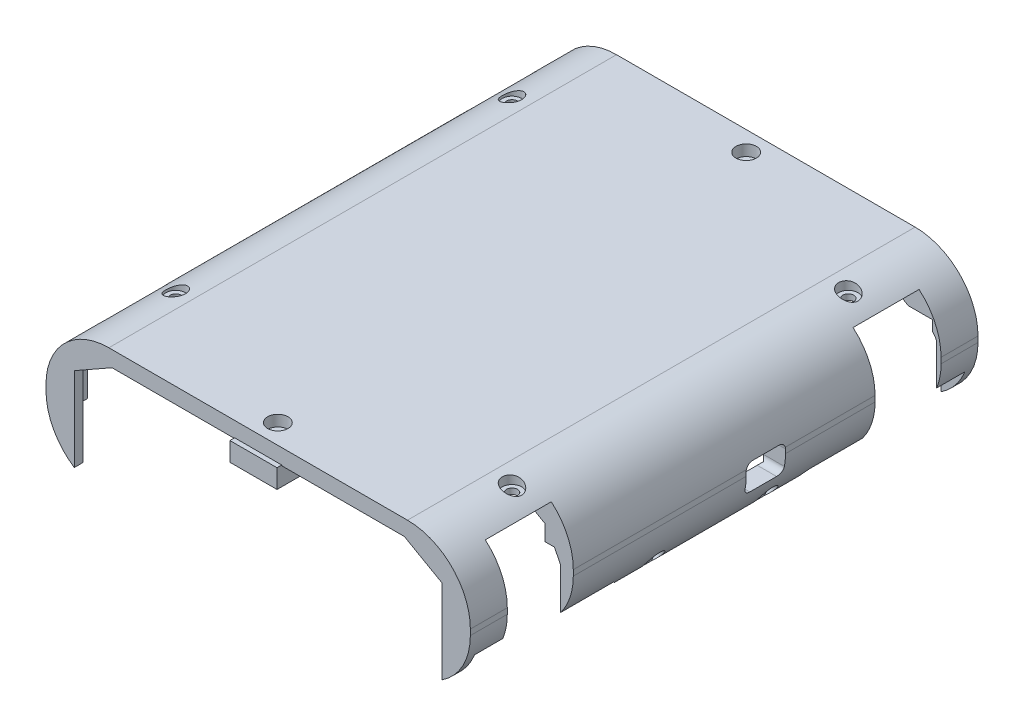
from build123d import *

# Parameters (mm, degrees)
BOSS_EXTRUDE1_DEPTH = 161.5
SKETCH11_W          = 21
SKETCH11_H          = 33.7
CUT_EXTRUDE7_DEPTH  = 214.141971465
CUT_EXTRUDE8_REACH  = 181.223
SKETCH12_R          = 1.75
SKETCH14_R          = 3.1
CUT_EXTRUDE9_DEPTH  = 3
CUT_EXTRUDE10_DEPTH = 9
BOSS_EXTRUDE5_DEPTH = 6
CUT_EXTRUDE11_REACH = 179.217
SKETCH20_R          = 1.75
SKETCH22_R          = 3.25
CUT_EXTRUDE12_DEPTH = 3.5
CUT_EXTRUDE13_START = -15
CUT_EXTRUDE13_DEPTH = 15
CHAMFER1_SIZE       = 7
MIRROR1_START       = -34
MIRROR1_OUTLINE_W   = 7.588235294
MIRROR1_OUTLINE_H   = 9
MIRROR1_DEPTH       = 18.20203721
MIRROR1_START_2     = -16.8
MIRROR1_2_OUTLINE_W = 6.338235294
MIRROR1_2_OUTLINE_H = 9
MIRROR1_2_DEPTH     = 10.8
MIRROR1_START_3     = 1.5
MIRROR1_3_OUTLINE_R = 3.25
MIRROR1_3_DEPTH     = 4.5
MIRROR1_4_OUTLINE_W = 1.25
MIRROR1_4_OUTLINE_H = 9
MIRROR1_4_DEPTH     = 5.4
MIRROR1_5_OUTLINE_R = 1.75
MIRROR1_5_DEPTH     = 1.5
MIRROR1_START_4     = -5.8
MIRROR1_6_OUTLINE_R = 1.75
MIRROR1_6_DEPTH     = 6
MIRROR1_START_5     = 32.75
MIRROR1_7_DEPTH     = 22
MIRROR1_START_6     = 149.75
MIRROR1_8_DEPTH     = 9
MIRROR1_START_7     = -15.79796279
MIRROR1_9_DEPTH     = 3.99796279
SKETCH24_W          = 32
SKETCH24_H          = 27
CUT_EXTRUDE14_DEPTH = 3
FILLET1_R           = 3
SKETCH25_W          = 8
SKETCH25_H          = 5
BOSS_EXTRUDE6_DEPTH = 8
CUT_EXTRUDE15_REACH = 119.19
CUT_EXTRUDE17_REACH = 216.281
SKETCH27_R          = 1.6
SKETCH28_R          = 3
CUT_EXTRUDE18_DEPTH = 7
SKETCH31_W          = 42
SKETCH31_H          = 65
CUT_EXTRUDE19_DEPTH = 6.8
SKETCH34_R          = 3
SKETCH34_W          = 6
SKETCH34_H          = 8.65
BOSS_EXTRUDE7_DEPTH = 3.5
SKETCH37_R          = 1.05
CUT_EXTRUDE21_DEPTH = 6.2
CUT_EXTRUDE22_DEPTH = 2
CUT_EXTRUDE23_REACH = 210.728
SKETCH40_W          = 12.5
SKETCH40_H          = 9
CHAMFER2_SIZE       = 2
FILLET2_R           = 2
SKETCH41_W          = 50
SKETCH41_H          = 4
SKETCH41_H_2        = 10
CUT_EXTRUDE24_DEPTH = 3.5
FILLET3_R           = 3.5
SKETCH43_R          = 3.5
BOSS_EXTRUDE8_DEPTH = 3
CUT_EXTRUDE28_REACH = 184.576
CUT_EXTRUDE28_START = 3
SKETCH48_W          = 11.5
SKETCH48_H          = 72
SKETCH44_R          = 2
CUT_EXTRUDE26_DEPTH = 5
CUT_EXTRUDE27_REACH = 210.728
SKETCH45_W          = 20
SKETCH45_H          = 8
CHAMFER3_SIZE       = 2
FILLET4_R           = 2
SKETCH46_R          = 2.75
SKETCH46_R_2        = 2.1
BOSS_EXTRUDE9_DEPTH = 2.3


with BuildPart() as part:
    # Sketch9 → Boss-Extrude1 (new body)
    with BuildSketch(Plane.XY):
        with BuildLine():
            Line((-47.5, 5), (47.5, 5))
            ThreePointArc((47.5, 5), (61.642135624, -0.857864376), (67.5, -15))
            Line((67.5, -15), (67.5, -16.8))
            ThreePointArc((67.5, -16.8), (65.106767147, -26.285383493), (58.5, -33.5))
            Line((58.5, -33.5), (58.5, -6.8))
            Line((58.5, -6.8), (46.5, 0))
            Line((46.5, 0), (-46.5, 0))
            Line((-46.5, 0), (-58.5, -6.8))
            Line((-58.5, -6.8), (-58.5, -33.5))
            ThreePointArc((-58.5, -33.5), (-65.106767147, -26.285383493), (-67.5, -16.8))
            Line((-67.5, -16.8), (-67.5, -15))
            ThreePointArc((-67.5, -15), (-61.642135624, -0.857864376), (-47.5, 5))
        make_face()
    extrude(amount=BOSS_EXTRUDE1_DEPTH)

    # Sketch11 → Cut-Extrude7 (cut, through all)
    with BuildSketch(Plane.ZY.offset(67.5)):
        with Locations((139.25, -16.65)):
            Rectangle(SKETCH11_W, SKETCH11_H)
        with Locations((22.25, -16.65)):
            Rectangle(SKETCH11_W, SKETCH11_H)
    extrude(amount=-CUT_EXTRUDE7_DEPTH, mode=Mode.SUBTRACT)

    # Sketch12 → Cut-Extrude8 (cut, up to next)
    with BuildSketch(Plane(origin=(0, 5, 0), x_dir=(1, 0, 0), z_dir=(0, 1, 0)), mode=Mode.PRIVATE) as cut_extrude8_sk1:
        with Locations(Location((-53.5, -134.25, 0), (0, 0, 270))):
            Circle(SKETCH12_R)
    cut_extrude8_tool1 = extrude(cut_extrude8_sk1.sketch, amount=-CUT_EXTRUDE8_REACH, mode=Mode.PRIVATE) & part.part
    # Sketch12 → Cut-Extrude8 (cut, up to next)
    with BuildSketch(Plane(origin=(0, 5, 0), x_dir=(1, 0, 0), z_dir=(0, 1, 0)), mode=Mode.PRIVATE) as cut_extrude8_sk2:
        with Locations(Location((-53.5, -27.25, 0), (0, 0, 270))):
            Circle(SKETCH12_R)
    cut_extrude8_tool2 = extrude(cut_extrude8_sk2.sketch, amount=-CUT_EXTRUDE8_REACH, mode=Mode.PRIVATE) & part.part
    # Sketch12 → Cut-Extrude8 (cut, up to next)
    with BuildSketch(Plane(origin=(0, 5, 0), x_dir=(1, 0, 0), z_dir=(0, 1, 0)), mode=Mode.PRIVATE) as cut_extrude8_sk3:
        with Locations(Location((53.5, -27.25, 0), (0, 0, 270))):
            Circle(SKETCH12_R)
    cut_extrude8_tool3 = extrude(cut_extrude8_sk3.sketch, amount=-CUT_EXTRUDE8_REACH, mode=Mode.PRIVATE) & part.part
    # Sketch12 → Cut-Extrude8 (cut, up to next)
    with BuildSketch(Plane(origin=(0, 5, 0), x_dir=(1, 0, 0), z_dir=(0, 1, 0)), mode=Mode.PRIVATE) as cut_extrude8_sk4:
        with Locations(Location((53.5, -134.25, 0), (0, 0, 270))):
            Circle(SKETCH12_R)
    cut_extrude8_tool4 = extrude(cut_extrude8_sk4.sketch, amount=-CUT_EXTRUDE8_REACH, mode=Mode.PRIVATE) & part.part
    add(cut_extrude8_tool1.solids().sort_by_distance((-53.5, 5, 134.25))[0], mode=Mode.SUBTRACT)
    add(cut_extrude8_tool2.solids().sort_by_distance((-53.5, 5, 27.25))[0], mode=Mode.SUBTRACT)
    add(cut_extrude8_tool3.solids().sort_by_distance((53.5, 5, 27.25))[0], mode=Mode.SUBTRACT)
    add(cut_extrude8_tool4.solids().sort_by_distance((53.5, 5, 134.25))[0], mode=Mode.SUBTRACT)

    # Sketch14 → Cut-Extrude9 (cut)
    with BuildSketch(Plane(origin=(0, 5, 0), x_dir=(1, 0, 0), z_dir=(0, 1, 0))):
        with Locations(Location((-53.5, -134.25, 0), (0, 0, 270))):
            Circle(SKETCH14_R)
        with Locations(Location((-53.5, -27.25, 0), (0, 0, 270))):
            Circle(SKETCH14_R)
        with Locations(Location((53.5, -27.25, 0), (0, 0, 270))):
            Circle(SKETCH14_R)
        with Locations(Location((53.5, -134.25, 0), (0, 0, 270))):
            Circle(SKETCH14_R)
    extrude(amount=-CUT_EXTRUDE9_DEPTH, mode=Mode.SUBTRACT)

    # Sketch16 → Cut-Extrude10 (cut)
    with BuildSketch(Plane.XY.offset(11.75)):
        with BuildLine():
            Line((57.088235294, -33.5), (66.088235294, -33.5))
            Line((66.088235294, -33.5), (66.088235294, -11.4))
            ThreePointArc((66.088235294, -11.4), (65.636772566, -10.291539205), (64.838235294, -9.4))
            Line((64.838235294, -9.4), (64.838235294, -6))
            Line((64.838235294, -6), (57.088235294, -6))
            Line((57.088235294, -6), (57.088235294, -33.5))
        make_face()
        with BuildLine():
            Line((-66.088235294, -33.5), (-66.088235294, -11.4))
            ThreePointArc((-66.088235294, -11.4), (-65.636772566, -10.291539205), (-64.838235294, -9.4))
            Line((-64.838235294, -9.4), (-64.838235294, -6))
            Line((-64.838235294, -6), (-57.088235294, -6))
            Line((-57.088235294, -6), (-57.088235294, -33.5))
            Line((-57.088235294, -33.5), (-66.088235294, -33.5))
        make_face()
    extrude(amount=-CUT_EXTRUDE10_DEPTH, mode=Mode.SUBTRACT)

    # Sketch19 → Boss-Extrude5 (add)
    with BuildSketch(Plane.XZ.offset(-0.2)):
        Polygon((-11.248461447, 25.25), (11.251538553, 25.25), (11.251538553, 12.25), (7.501538553, 12.25), (7.501538553, -1.5), (-7.498461447, -1.5), (-7.498461447, 12.25), (-11.248461447, 12.25), align=None)
    extrude(amount=BOSS_EXTRUDE5_DEPTH)

    # Sketch20 → Cut-Extrude11 (cut, up to next)
    with BuildSketch(Plane.XZ.offset(5.8), mode=Mode.PRIVATE) as cut_extrude11_sk1:
        with Locations(Location((0.001538553, 6.25, 0), (0, 0, 270))):
            Circle(SKETCH20_R)
    cut_extrude11_tool1 = extrude(cut_extrude11_sk1.sketch, amount=-CUT_EXTRUDE11_REACH, mode=Mode.PRIVATE) & part.part
    add(cut_extrude11_tool1.solids().sort_by_distance((0.001539, -5.8, 6.25))[0], mode=Mode.SUBTRACT)

    # Sketch22 → Cut-Extrude12 (cut)
    with BuildSketch(Plane(origin=(0, 5, 0), x_dir=(1, 0, 0), z_dir=(0, 1, 0))):
        with Locations(Location((0.001538553, -6.25, 0), (0, 0, 270))):
            Circle(SKETCH22_R)
    extrude(amount=-CUT_EXTRUDE12_DEPTH, mode=Mode.SUBTRACT)

    # Sketch23 → Cut-Extrude13 (cut)
    with BuildSketch(Plane.XY.offset(128.75).offset(CUT_EXTRUDE13_START)):
        with BuildLine():
            Line((-58.5, -11.8), (-58.5, -33.5))
            ThreePointArc((-58.5, -33.5), (-61.203275994, -31.365138759), (-63.5, -28.79796279))
            Line((-63.5, -28.79796279), (-63.5, -15.79796279))
            Line((-63.5, -15.79796279), (-61.5, -11.8))
            Line((-61.5, -11.8), (-58.5, -11.8))
        make_face()
        with BuildLine():
            Line((63.5, -15.79796279), (63.5, -28.79796279))
            ThreePointArc((63.5, -28.79796279), (61.203275994, -31.365138759), (58.5, -33.5))
            Line((58.5, -33.5), (58.5, -11.8))
            Line((58.5, -11.8), (61.5, -11.8))
            Line((61.5, -11.8), (63.5, -15.79796279))
        make_face()
    extrude(amount=CUT_EXTRUDE13_DEPTH, mode=Mode.SUBTRACT)

    # Chamfer1
    # the kernel refuses this chamfer: 7 mm, written as the material it takes off along each edge
    with BuildSketch(Plane(origin=(-58.5, -11.8, 113.75), x_dir=(0, 0, -1), z_dir=(0, -1, 0))) as chamfer1_piece_1_section:
        Polygon((CHAMFER1_SIZE, 0), (0, -CHAMFER1_SIZE), (0, 0), align=None)
    chamfer1_piece_1 = extrude(amount=39.701780916, mode=Mode.PRIVATE)
    chamfer1_piece_1 = split(chamfer1_piece_1, bisect_by=Plane(origin=(-60.899510796, -10.599633252, 113.75), z_dir=(0.8943360284912045, -0.4473958740786281, 0)), keep=Keep.TOP, mode=Mode.PRIVATE)
    chamfer1_piece_1 = split(chamfer1_piece_1, bisect_by=Plane(origin=(-63.5, -11.8, 113.75), z_dir=(1, 0, 0)), keep=Keep.TOP, mode=Mode.PRIVATE)
    add(chamfer1_piece_1, mode=Mode.SUBTRACT)
    with BuildSketch(Plane(origin=(58.5, -51.501780916, 113.75), x_dir=(0, 0, -1), z_dir=(0, 1, 0))) as chamfer1_piece_2_section:
        Polygon((CHAMFER1_SIZE, 0), (0, -CHAMFER1_SIZE), (0, 0), align=None)
    chamfer1_piece_2 = extrude(amount=39.701780916, mode=Mode.PRIVATE)
    chamfer1_piece_2 = split(chamfer1_piece_2, bisect_by=Plane(origin=(63.5, -51.501780916, 113.75), z_dir=(-1, 0, 0)), keep=Keep.TOP, mode=Mode.PRIVATE)
    chamfer1_piece_2 = split(chamfer1_piece_2, bisect_by=Plane(origin=(76.785076672, -42.354583889, 113.75), z_dir=(-0.8943360284912032, -0.4473958740786306, 0)), keep=Keep.TOP, mode=Mode.PRIVATE)
    add(chamfer1_piece_2, mode=Mode.SUBTRACT)

    # Mirror1: read off the stored shape, not the designer's step
    # Mirror1 outline → Mirror1 (cut)
    with BuildSketch(Plane(origin=(0, 0, 0), x_dir=(1, 0, 0), z_dir=(0, 1, 0)).offset(MIRROR1_START)):
        with Locations((62.294117647, -154.25)):
            Rectangle(MIRROR1_OUTLINE_W, MIRROR1_OUTLINE_H)
        with Locations((-62.294117647, -154.25)):
            Rectangle(MIRROR1_OUTLINE_W, MIRROR1_OUTLINE_H)
        Polygon((-58.5, -54.75), (-58.5, -32.75), (-63.5, -32.75), (-63.5, -49.75), align=None)
        Polygon((63.5, -49.75), (63.5, -32.75), (58.5, -32.75), (58.5, -54.75), align=None)
    extrude(amount=MIRROR1_DEPTH, mode=Mode.SUBTRACT)

    # Mirror1 2 outline → Mirror1 2 (cut)
    with BuildSketch(Plane(origin=(0, 0, 0), x_dir=(1, 0, 0), z_dir=(0, 1, 0)).offset(MIRROR1_START_2)):
        with Locations((61.669117647, -154.25)):
            Rectangle(MIRROR1_2_OUTLINE_W, MIRROR1_2_OUTLINE_H)
        with Locations((-61.669117647, -154.25)):
            Rectangle(MIRROR1_2_OUTLINE_W, MIRROR1_2_OUTLINE_H)
    extrude(amount=MIRROR1_2_DEPTH, mode=Mode.SUBTRACT)

    # Mirror1 3 outline → Mirror1 3 (cut)
    with BuildSketch(Plane(origin=(0, 0, 0), x_dir=(1, 0, 0), z_dir=(0, 1, 0)).offset(MIRROR1_START_3)):
        with Locations((0.001538553, -155.25)):
            Circle(MIRROR1_3_OUTLINE_R)
    extrude(amount=MIRROR1_3_DEPTH, mode=Mode.SUBTRACT)

    # Mirror1 4 outline → Mirror1 4 (cut)
    with BuildSketch(Plane(origin=(0, 0, 0), x_dir=(1, 0, 0), z_dir=(0, 1, 0)).offset(MIRROR1_START_2)):
        with Locations((-65.463235294, -154.25)):
            Rectangle(MIRROR1_4_OUTLINE_W, MIRROR1_4_OUTLINE_H)
        with Locations((65.463235294, -154.25)):
            Rectangle(MIRROR1_4_OUTLINE_W, MIRROR1_4_OUTLINE_H)
    extrude(amount=MIRROR1_4_DEPTH, mode=Mode.SUBTRACT)

    # Mirror1 5 outline → Mirror1 5 (cut)
    with BuildSketch(Plane(origin=(0, 0, 0), x_dir=(1, 0, 0), z_dir=(0, 1, 0))):
        with Locations((0.001538553, -155.25)):
            Circle(MIRROR1_5_OUTLINE_R)
    extrude(amount=MIRROR1_5_DEPTH, mode=Mode.SUBTRACT)

    # Mirror1 6 outline → Mirror1 6 (add)
    with BuildSketch(Plane(origin=(0, 0, 0), x_dir=(1, 0, 0), z_dir=(0, 1, 0)).offset(MIRROR1_START_4)):
        Polygon((-7.498461447, -149.25), (-7.498461447, -163), (7.501538553, -163), (7.501538553, -149.25), (11.251538553, -149.25), (11.251538553, -136.25), (-11.248461447, -136.25), (-11.248461447, -149.25), align=None)
        with Locations((0.001538553, -155.25)):
            Circle(MIRROR1_6_OUTLINE_R, mode=Mode.SUBTRACT)
    extrude(amount=MIRROR1_6_DEPTH)

    # Mirror1 7 outline → Mirror1 7 (cut)
    with BuildSketch(Plane.XY.offset(MIRROR1_START_5)):
        Polygon((-58.5, -15.79796279), (-58.5, -11.8), (-61.5, -11.8), (-63.5, -15.79796279), align=None)
        Polygon((61.5, -11.8), (58.5, -11.8), (58.5, -15.79796279), (63.5, -15.79796279), align=None)
    extrude(amount=MIRROR1_7_DEPTH, mode=Mode.SUBTRACT)

    # Mirror1 8 outline → Mirror1 8 (cut)
    with BuildSketch(Plane.XY.offset(MIRROR1_START_6)):
        Polygon((-57.088235294, -6), (-58.5, -6), (-58.5, -6.8), align=None)
        with BuildLine():
            ThreePointArc((-64.838235294, -9.4), (-65.636772566, -10.291539205), (-66.088235294, -11.4))
            Line((-66.088235294, -11.4), (-64.838235294, -11.4))
            Line((-64.838235294, -11.4), (-64.838235294, -9.4))
        make_face()
        with BuildLine():
            ThreePointArc((66.088235294, -11.4), (65.636772566, -10.291539205), (64.838235294, -9.4))
            Line((64.838235294, -9.4), (64.838235294, -11.4))
            Line((64.838235294, -11.4), (66.088235294, -11.4))
        make_face()
        Polygon((58.5, -6), (57.088235294, -6), (58.5, -6.8), align=None)
    extrude(amount=MIRROR1_8_DEPTH, mode=Mode.SUBTRACT)

    # Mirror1 9 outline → Mirror1 9 (add)
    with BuildSketch(Plane(origin=(0, 0, 0), x_dir=(1, 0, 0), z_dir=(0, 1, 0)).offset(MIRROR1_START_7)):
        Polygon((65, -48.25), (58.5, -54.75), (65, -54.75), align=None)
        Polygon((-58.5, -54.75), (-65, -48.25), (-65, -54.75), align=None)
    extrude(amount=MIRROR1_9_DEPTH)

    # Sketch24 → Cut-Extrude14 (cut)
    with BuildSketch(Plane.XZ):
        with Locations((0, 86.75)):
            Rectangle(SKETCH24_W, SKETCH24_H)
    extrude(amount=-CUT_EXTRUDE14_DEPTH, mode=Mode.SUBTRACT)

    # Fillet1
    fillet1_edges = [part.edges().sort_by_distance(p)[0] for p in [
        (-16, 3, 86.75),
        (16, 3, 86.75),
    ]]
    fillet(fillet1_edges, radius=FILLET1_R - 0.0001)  # a hair under: the kernel refuses the full size

    # Sketch25 → Boss-Extrude6 (add)
    with BuildSketch(Plane.XZ):
        with Locations((17, 70.75)):
            Rectangle(SKETCH25_W, SKETCH25_H)
        with Locations((-17, 70.75)):
            Rectangle(SKETCH25_W, SKETCH25_H)
    boss_extrude6 = extrude(amount=BOSS_EXTRUDE6_DEPTH)

    # Sketch26 → Cut-Extrude15 (cut, up to next)
    with BuildSketch(Plane.XY.offset(73.25), mode=Mode.PRIVATE) as cut_extrude15_sk1:
        Polygon((21, -1), (21, -8), (15.5, -8), align=None)
    cut_extrude15_tool1 = extrude(cut_extrude15_sk1.sketch, amount=-CUT_EXTRUDE15_REACH, mode=Mode.PRIVATE) & part.part
    # Sketch26 → Cut-Extrude15 (cut, up to next)
    with BuildSketch(Plane.XY.offset(73.25), mode=Mode.PRIVATE) as cut_extrude15_sk2:
        Polygon((-15.5, -8), (-21, -1), (-21, -8), align=None)
    cut_extrude15_tool2 = extrude(cut_extrude15_sk2.sketch, amount=-CUT_EXTRUDE15_REACH, mode=Mode.PRIVATE) & part.part
    cut_extrude15_1 = cut_extrude15_tool1.solids().sort_by_distance((19.166667, -5.666667, 73.25))[0]
    add(cut_extrude15_1, mode=Mode.SUBTRACT)
    cut_extrude15_2 = cut_extrude15_tool2.solids().sort_by_distance((-19.166667, -5.666667, 73.25))[0]
    add(cut_extrude15_2, mode=Mode.SUBTRACT)
    cut_extrude15 = cut_extrude15_1 + cut_extrude15_2  # Cut-Extrude15 as one shape, for the pattern or mirror that repeats it

    # Mirror2: Boss-Extrude6, Cut-Extrude15 across plane
    add(boss_extrude6.mirror(Plane.XY.offset(86.75)))
    add(cut_extrude15.mirror(Plane.XY.offset(86.75)), mode=Mode.SUBTRACT)

    # Sketch27 → Cut-Extrude17 (cut, up to next)
    with BuildSketch(Plane(origin=(67.5, 0, 0), x_dir=(0, 0, -1), z_dir=(1, 0, 0)), mode=Mode.PRIVATE) as cut_extrude17_sk1:
        with Locations(Location((-98.75, -29.5, 0), (0, 0, 90))):
            Circle(SKETCH27_R)
    cut_extrude17_tool1 = extrude(cut_extrude17_sk1.sketch, amount=-CUT_EXTRUDE17_REACH, mode=Mode.PRIVATE) & part.part
    # Sketch27 → Cut-Extrude17 (cut, up to next)
    with BuildSketch(Plane(origin=(67.5, 0, 0), x_dir=(0, 0, -1), z_dir=(1, 0, 0)), mode=Mode.PRIVATE) as cut_extrude17_sk2:
        with Locations(Location((-62.75, -29.5, 0), (0, 0, 90))):
            Circle(SKETCH27_R)
    cut_extrude17_tool2 = extrude(cut_extrude17_sk2.sketch, amount=-CUT_EXTRUDE17_REACH, mode=Mode.PRIVATE) & part.part
    cut_extrude17_1 = cut_extrude17_tool1.solids().sort_by_distance((67.5, -29.5, 98.75))[0]
    add(cut_extrude17_1, mode=Mode.SUBTRACT)
    cut_extrude17_2 = cut_extrude17_tool2.solids().sort_by_distance((67.5, -29.5, 62.75))[0]
    add(cut_extrude17_2, mode=Mode.SUBTRACT)
    cut_extrude17 = cut_extrude17_1 + cut_extrude17_2  # Cut-Extrude17 as one shape, for the pattern or mirror that repeats it

    # Sketch28 → Cut-Extrude18 (cut)
    with BuildSketch(Plane(origin=(67.5, 0, 0), x_dir=(0, 0, -1), z_dir=(1, 0, 0))):
        with Locations((-98.75, -29.5)):
            Circle(SKETCH28_R)
        with Locations((-62.75, -29.5)):
            Circle(SKETCH28_R)
    cut_extrude18 = extrude(amount=-CUT_EXTRUDE18_DEPTH, mode=Mode.SUBTRACT)

    # Mirror3: Cut-Extrude17, Cut-Extrude18 across plane
    add(cut_extrude17.mirror(Plane(origin=(0, 0, 0), x_dir=(0, 0, 1), z_dir=(1, 0, 0))), mode=Mode.SUBTRACT)
    add(cut_extrude18.mirror(Plane(origin=(0, 0, 0), x_dir=(0, 0, 1), z_dir=(1, 0, 0))), mode=Mode.SUBTRACT)

    # Sketch31 → Cut-Extrude19 (cut)
    with BuildSketch(Plane.XZ):
        with Locations((37.5, 80.75)):
            Rectangle(SKETCH31_W, SKETCH31_H)
    extrude(amount=CUT_EXTRUDE19_DEPTH, mode=Mode.SUBTRACT)

    # Sketch34 → Boss-Extrude7 (add)
    with BuildSketch(Plane.XZ):
        with Locations(Location((19.5, 108.6, 0), (0, 0, 90))):
            Circle(SKETCH34_R)
        with Locations(Location((19.5, 52.9, 0), (0, 0, 90))):
            Circle(SKETCH34_R)
        with Locations((55.5, 108.925)):
            Rectangle(SKETCH34_W, SKETCH34_H)
        with Locations((55.5, 52.575)):
            Rectangle(SKETCH34_W, SKETCH34_H)
    extrude(amount=BOSS_EXTRUDE7_DEPTH)

    # Sketch37 → Cut-Extrude21 (cut)
    with BuildSketch(Plane.XZ.offset(3.5)):
        with Locations(Location((19.5, 108.6, 0), (0, 0, 270))):
            Circle(SKETCH37_R)
        with Locations(Location((19.5, 52.9, 0), (0, 0, 270))):
            Circle(SKETCH37_R)
        with Locations(Location((55.549682172, 108.6, 0), (0, 0, 270))):
            Circle(SKETCH37_R)
        with Locations(Location((55.549682172, 52.9, 0), (0, 0, 270))):
            Circle(SKETCH37_R)
    extrude(amount=-CUT_EXTRUDE21_DEPTH, mode=Mode.SUBTRACT)

    # Sketch38 → Cut-Extrude22 (cut)
    with BuildSketch(Plane.XZ):
        with BuildLine():
            Line((21.632580596, 110.71), (18.281790932, 110.71))
            Line((18.281790932, 110.71), (17.063581864, 108.6))
            Line((17.063581864, 108.6), (18.281790932, 106.49))
            Line((18.281790932, 106.49), (21.632580596, 106.49))
            ThreePointArc((21.632580596, 106.49), (22.5, 108.6), (21.632580596, 110.71))
        make_face()
        Polygon((56.76789124, 106.49), (52.5, 106.49), (52.5, 110.71), (56.76789124, 110.71), (57.986100308, 108.6), align=None)
        Polygon((52.5, 50.79), (56.76789124, 50.79), (57.986100308, 52.9), (56.76789124, 55.01), (52.5, 55.01), align=None)
        with BuildLine():
            Line((18.281790932, 55.01), (21.632580596, 55.01))
            ThreePointArc((21.632580596, 55.01), (22.5, 52.9), (21.632580596, 50.79))
            Line((21.632580596, 50.79), (18.281790932, 50.79))
            Line((18.281790932, 50.79), (17.063581864, 52.9))
            Line((17.063581864, 52.9), (18.281790932, 55.01))
        make_face()
    extrude(amount=CUT_EXTRUDE22_DEPTH, mode=Mode.SUBTRACT)

    # Sketch40 → Cut-Extrude23 (cut, up to next)
    with BuildSketch(Plane.ZY.offset(-58.5), mode=Mode.PRIVATE) as cut_extrude23_sk1:
        with Locations((67.5, -18)):
            Rectangle(SKETCH40_W, SKETCH40_H)
    cut_extrude23_tool1 = extrude(cut_extrude23_sk1.sketch, amount=-CUT_EXTRUDE23_REACH, mode=Mode.PRIVATE) & part.part
    add(cut_extrude23_tool1.solids().sort_by_distance((58.5, -18, 67.5))[0], mode=Mode.SUBTRACT)

    # Chamfer2
    chamfer2_edges = [part.edges().sort_by_distance(p)[0] for p in [
        (58.5, -18, 73.75),
        (58.5, -13.5, 67.5),
        (58.5, -18, 61.25),
        (58.5, -22.5, 67.5),
    ]]
    chamfer(chamfer2_edges, length=CHAMFER2_SIZE)

    # Fillet2
    fillet2_edges = [part.edges().sort_by_distance(p)[0] for p in [
        (63.971835338, -13.5, 73.75),
        (63.585142918, -22.5, 73.75),
        (63.585142918, -22.5, 61.25),
        (63.971835338, -13.5, 61.25),
    ]]
    fillet(fillet2_edges, radius=FILLET2_R)

    # Sketch41 → Cut-Extrude24 (cut)
    with BuildSketch(Plane.XZ):
        with Locations((0, 120.75)):
            Rectangle(SKETCH41_W, SKETCH41_H)
        with Locations((0, 113.75)):
            Rectangle(SKETCH41_W, SKETCH41_H)
        with Locations((0, 41.25)):
            Rectangle(SKETCH41_W, SKETCH41_H_2)
    extrude(amount=-CUT_EXTRUDE24_DEPTH, mode=Mode.SUBTRACT)

    # Fillet3
    fillet3_edges = [part.edges().sort_by_distance(p)[0] for p in [
        (-25, 3.5, 113.75),
        (-25, 3.5, 120.75),
        (25, 3.5, 113.75),
        (25, 3.5, 120.75),
    ]]
    fillet(fillet3_edges, radius=FILLET3_R - 0.0001)  # a hair under: the kernel refuses the full size

    # Sketch43 → Boss-Extrude8 (add)
    with BuildSketch(Plane.XZ):
        with Locations((-54.5, 111.75)):
            Circle(SKETCH43_R)
        with Locations((-54.5, 49.75)):
            Circle(SKETCH43_R)
        with Locations(Location((-23.6, 49.75, 0), (0, 0, 270))):
            Circle(SKETCH43_R)
    extrude(amount=BOSS_EXTRUDE8_DEPTH)

    # Sketch48 → Cut-Extrude28 (cut, up to next)
    with BuildSketch(Plane.XZ.offset(CUT_EXTRUDE28_START), mode=Mode.PRIVATE) as cut_extrude28_sk1:
        with Locations((-52.25, 80.75)):
            Rectangle(SKETCH48_W, SKETCH48_H)
    cut_extrude28_tool1 = extrude(cut_extrude28_sk1.sketch, amount=CUT_EXTRUDE28_REACH, mode=Mode.PRIVATE) & part.part
    add(cut_extrude28_tool1.solids().sort_by_distance((-52.25, -3, 80.75))[0], mode=Mode.SUBTRACT)

    # Sketch44 → Cut-Extrude26 (cut)
    with BuildSketch(Plane.XZ.offset(3)):
        with Locations(Location((-54.5, 111.75, 0), (0, 0, 270))):
            Circle(SKETCH44_R)
        with Locations(Location((-54.5, 49.75, 0), (0, 0, 270))):
            Circle(SKETCH44_R)
        with Locations(Location((-23.6, 49.75, 0), (0, 0, 270))):
            Circle(SKETCH44_R)
    extrude(amount=-CUT_EXTRUDE26_DEPTH, mode=Mode.SUBTRACT)

    # Sketch45 → Cut-Extrude27 (cut, up to next)
    with BuildSketch(Plane(origin=(-58.5, 0, 0), x_dir=(0, 0, -1), z_dir=(1, 0, 0)), mode=Mode.PRIVATE) as cut_extrude27_sk1:
        with Locations((-83.25, -13)):
            Rectangle(SKETCH45_W, SKETCH45_H)
    cut_extrude27_tool1 = extrude(cut_extrude27_sk1.sketch, amount=-CUT_EXTRUDE27_REACH, mode=Mode.PRIVATE) & part.part
    add(cut_extrude27_tool1.solids().sort_by_distance((-58.5, -13, 83.25))[0], mode=Mode.SUBTRACT)

    # Chamfer3
    chamfer3_edges = [part.edges().sort_by_distance(p)[0] for p in [
        (-58.5, -13, 93.25),
        (-58.5, -17, 83.25),
        (-58.5, -13, 73.25),
        (-58.5, -9, 83.25),
    ]]
    chamfer(chamfer3_edges, length=CHAMFER3_SIZE)

    # Fillet4
    fillet4_edges = [part.edges().sort_by_distance(p)[0] for p in [
        (-63.999499835, -17, 73.25),
        (-63.999499835, -17, 93.25),
        (-63.539392014, -9, 93.25),
        (-63.539392014, -9, 73.25),
    ]]
    fillet(fillet4_edges, radius=FILLET4_R)

    # Sketch46 → Boss-Extrude9 (add)
    # profile 1 of 3: a face of its own
    with BuildSketch(Plane.XZ.offset(3)):
        with Locations(Location((-54.5, 111.75, 0), (0, 0, 270))):
            Circle(SKETCH46_R)
        with Locations(Location((-54.5, 111.75, 0), (0, 0, 270))):
            Circle(SKETCH46_R_2, mode=Mode.SUBTRACT)
    # profile 2 of 3: a face of its own
    with BuildSketch(Plane.XZ.offset(3)):
        with Locations(Location((-54.5, 49.75, 0), (0, 0, 270))):
            Circle(SKETCH46_R)
        with Locations(Location((-54.5, 49.75, 0), (0, 0, 270))):
            Circle(SKETCH46_R_2, mode=Mode.SUBTRACT)
    # profile 3 of 3: a face of its own
    with BuildSketch(Plane.XZ.offset(3)):
        with Locations(Location((-23.6, 49.75, 0), (0, 0, 270))):
            Circle(SKETCH46_R)
        with Locations(Location((-23.6, 49.75, 0), (0, 0, 270))):
            Circle(SKETCH46_R_2, mode=Mode.SUBTRACT)
    extrude(amount=BOSS_EXTRUDE9_DEPTH)


solid = part.part
